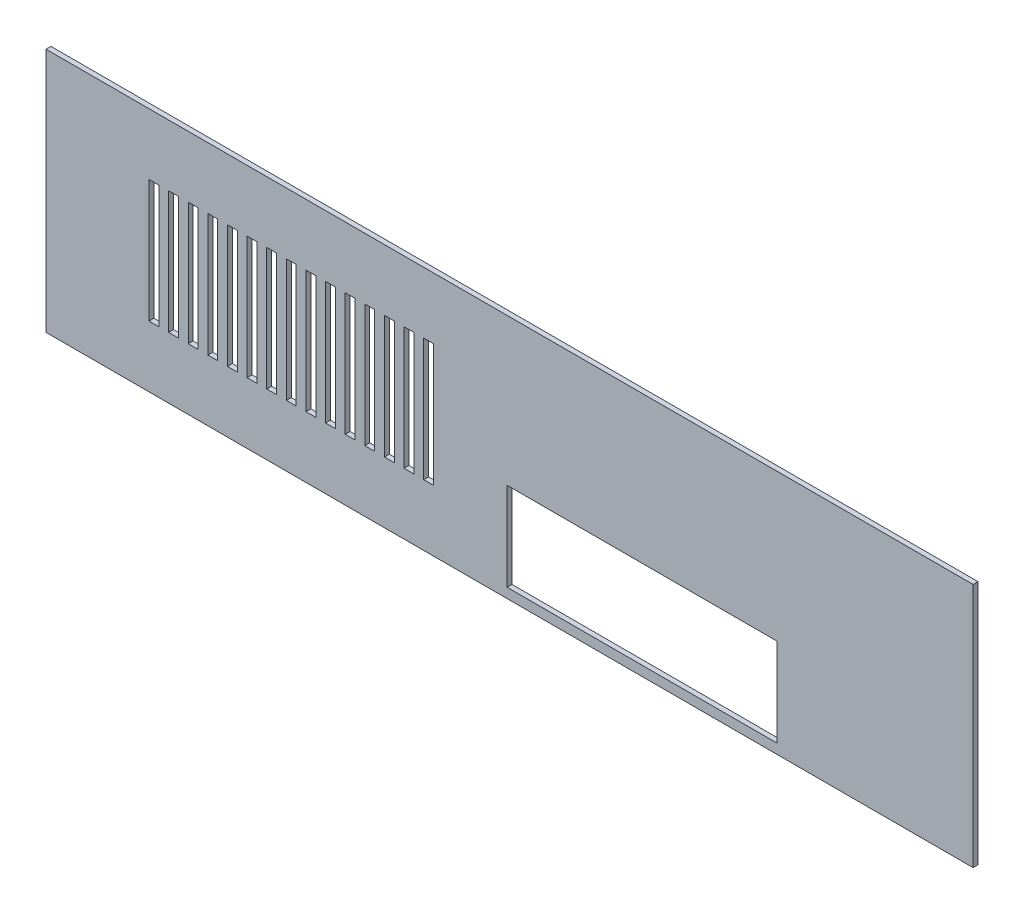
from build123d import *

# Parameters (mm, degrees)
SKETCH1_W           = 189
SKETCH1_H           = 50
BOSS_EXTRUDE1_DEPTH = 1
SKETCH2_W           = 55
SKETCH2_H           = 18
CUT_EXTRUDE1_DEPTH  = 134.866581758
SKETCH3_W           = 2
SKETCH3_H           = 25
CUT_EXTRUDE2_DEPTH  = 134.866581758


with BuildPart() as part:
    # Sketch1 → Boss-Extrude1 (new body)
    with BuildSketch(Plane.XY):
        with Locations((32.8655586, 16.198012015)):
            Rectangle(SKETCH1_W, SKETCH1_H)
    extrude(amount=BOSS_EXTRUDE1_DEPTH)

    # Sketch2 → Cut-Extrude1 (cut, through all)
    with BuildSketch(Plane.XY.offset(1)):
        with Locations((59.8655586, 2.198012015)):
            Rectangle(SKETCH2_W, SKETCH2_H)
    extrude(amount=-CUT_EXTRUDE1_DEPTH, mode=Mode.SUBTRACT)

    # Sketch3 → Cut-Extrude2 (cut, through all)
    with BuildSketch(Plane(origin=(0, 0, 0), x_dir=(-1, 0, 0), z_dir=(0, 0, -1))):
        with Locations((-12.3655586, 16.198012015)):
            Rectangle(SKETCH3_W, SKETCH3_H)
        with Locations((-16.3655586, 16.198012015)):
            Rectangle(SKETCH3_W, SKETCH3_H)
        with Locations((-8.3655586, 16.198012015)):
            Rectangle(SKETCH3_W, SKETCH3_H)
        with Locations((-4.3655586, 16.198012015)):
            Rectangle(SKETCH3_W, SKETCH3_H)
        with Locations((-0.3655586, 16.198012015)):
            Rectangle(SKETCH3_W, SKETCH3_H)
        with Locations((3.6344414, 16.198012015)):
            Rectangle(SKETCH3_W, SKETCH3_H)
        with Locations((7.6344414, 16.198012015)):
            Rectangle(SKETCH3_W, SKETCH3_H)
        with Locations((11.6344414, 16.198012015)):
            Rectangle(SKETCH3_W, SKETCH3_H)
        with Locations((15.6344414, 16.198012015)):
            Rectangle(SKETCH3_W, SKETCH3_H)
        with Locations((19.6344414, 16.198012015)):
            Rectangle(SKETCH3_W, SKETCH3_H)
        with Locations((23.6344414, 16.198012015)):
            Rectangle(SKETCH3_W, SKETCH3_H)
        with Locations((27.6344414, 16.198012015)):
            Rectangle(SKETCH3_W, SKETCH3_H)
        with Locations((31.6344414, 16.198012015)):
            Rectangle(SKETCH3_W, SKETCH3_H)
        with Locations((35.6344414, 16.198012015)):
            Rectangle(SKETCH3_W, SKETCH3_H)
        with Locations((39.6344414, 16.198012015)):
            Rectangle(SKETCH3_W, SKETCH3_H)
    extrude(amount=-CUT_EXTRUDE2_DEPTH, mode=Mode.SUBTRACT)


solid = part.part
